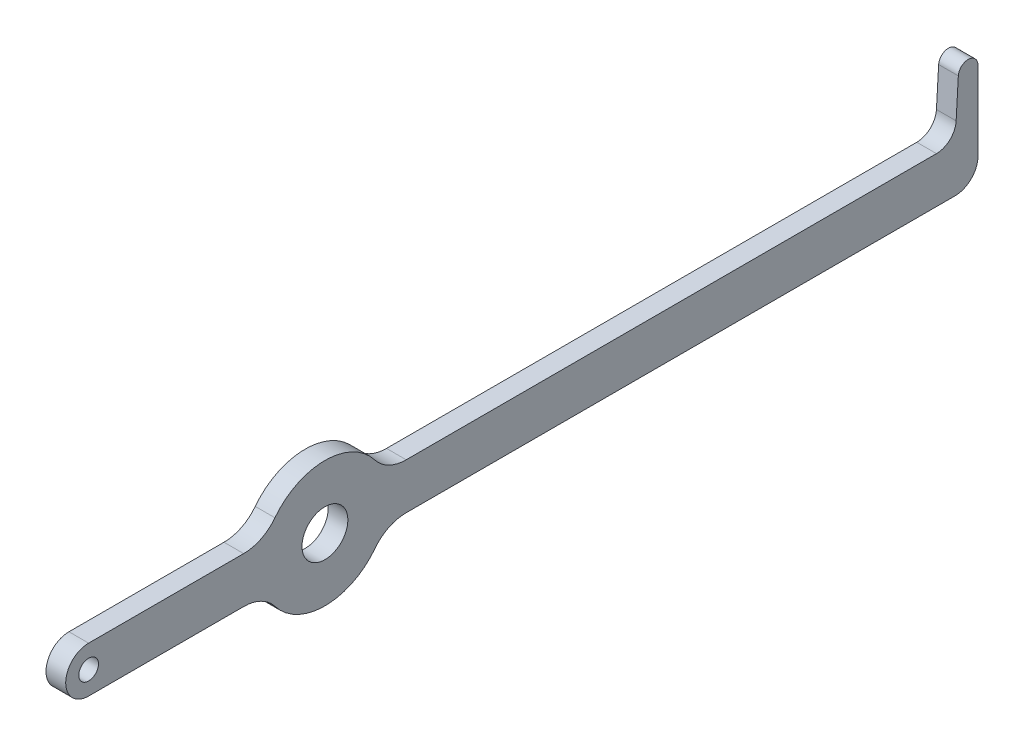
from build123d import *

# Parameters (mm, degrees)
SKETCH1_R               = 3.698033758
BOSS_EXTRUDE1_DEPTH     = 1.5875
FILLET1_R               = 6.35
BOSS_EXTRUDE2_DEPTH     = 1.5875
FILLET2_R               = 3.175
CUT_EXTRUDE1_DEPTH      = 107.31034378
CUT_EXTRUDE1_DEPTH_BACK = 107.31034378
SKETCH3_R               = 1.5875


with BuildPart() as part:
    # Sketch1 → Boss-Extrude1 (new, symmetric)
    with BuildSketch(Plane(origin=(0, 0, 0), x_dir=(0, 0, -1), z_dir=(1, 0, 0))):
        with BuildLine():
            ThreePointArc((-9.463093909, -3.698033758), (0, -10.16), (9.463093909, -3.698033758))
            Line((9.463093909, -3.698033758), (101.6, -3.698033758))
            ThreePointArc((101.6, -3.698033758), (105.298033758, 0), (101.6, 3.698033758))
            Line((101.6, 3.698033758), (9.463093909, 3.698033758))
            ThreePointArc((9.463093909, 3.698033758), (0, 10.16), (-9.463093909, 3.698033758))
            Line((-9.463093909, 3.698033758), (-38.1, 3.698033758))
            ThreePointArc((-38.1, 3.698033758), (-41.798033758, 0), (-38.1, -3.698033758))
            Line((-38.1, -3.698033758), (-9.463093909, -3.698033758))
        make_face()
        Circle(SKETCH1_R, mode=Mode.SUBTRACT)
    extrude(amount=BOSS_EXTRUDE1_DEPTH, both=True)

    # Fillet1
    fillet1_edges = [part.edges().sort_by_distance(p)[0] for p in [
        (0, 3.698033758, -9.463093909),
        (0, -3.698033758, -9.463093909),
        (0, -3.698033758, 9.463093909),
        (0, 3.698033758, 9.463093909),
    ]]
    fillet(fillet1_edges, radius=FILLET1_R)

    # Sketch2 → Boss-Extrude2 (add, symmetric)
    with BuildSketch(Plane(origin=(0, 0, 0), x_dir=(0, 0, -1), z_dir=(1, 0, 0))):
        with BuildLine():
            Line((105.298033758, 0), (105.298033758, 12.7))
            ThreePointArc((105.298033758, 12.7), (103.756361287, 14.286838394), (102.125679632, 12.79161686))
            Line((102.125679632, 12.79161686), (101.6, 3.698033758))
            ThreePointArc((101.6, 3.698033758), (104.214904747, 2.614904747), (105.298033758, 0))
        make_face()
    extrude(amount=BOSS_EXTRUDE2_DEPTH, both=True)

    # Fillet2
    fillet2_edges = [part.edges().sort_by_distance(p)[0] for p in [
        (0, 3.698033758, -101.6),
    ]]
    fillet(fillet2_edges, radius=FILLET2_R)

    # Sketch3 → Cut-Extrude1 (cut, two sides: drawn at the far end of the back side and taken through both)
    with BuildSketch(Plane(origin=(1.5875, 0, 0), x_dir=(0, 0, -1), z_dir=(1, 0, 0)).offset(-CUT_EXTRUDE1_DEPTH_BACK)):
        with Locations((-38.1, 0)):
            Circle(SKETCH3_R)
    extrude(amount=CUT_EXTRUDE1_DEPTH + CUT_EXTRUDE1_DEPTH_BACK, mode=Mode.SUBTRACT)


solid = part.part
